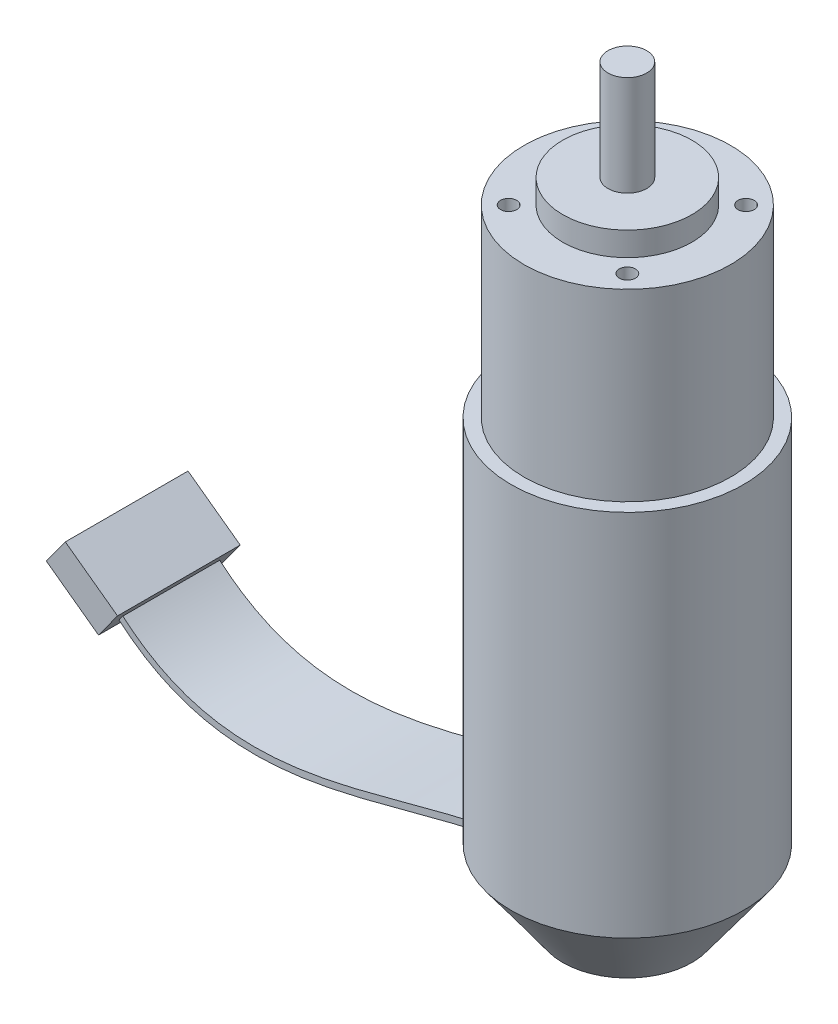
from build123d import *

# Parameters (mm, degrees)
SWEEP1_START              = -7.5
SWEEP1_DEPTH              = 15
SKETCH4_W                 = 19
SKETCH4_H                 = 5
BOSS_EXTRUDE1_DEPTH       = 10
M3X0_5_TAPPED_HOLE1_D     = 2.5
M3X0_5_TAPPED_HOLE1_DEPTH = 7.5
M3X0_5_TAPPED_HOLE1_TIP   = 0.751075774


with BuildPart() as part:
    # Sketch1 → Revolve1 (revolve)
    with BuildSketch(Plane.XY, mode=Mode.PRIVATE) as revolve1_sk:
        Polygon((0, 0), (-10, 0), (-18, 11), (-18, 68.1), (-16, 68.1), (-16, 96.6), (-10, 96.6), (-10, 100.3), (-3, 100.3), (-3, 115.8), (0, 115.8), align=None)
    revolve(revolve1_sk.sketch.rotate(Axis((0, 115.8, 0), (0, -1, 0)), 270), axis=Axis((0, 115.8, 0), (0, -1, 0)))

    # Sweep1: read off the stored shape, not the designer's step
    # Sweep1 outline → Sweep1 (add)
    with BuildSketch(Plane.XY.offset(SWEEP1_START)):
        with BuildLine():
            add(Edge.make_bspline(
                [(-15.28930073, 9.665917189), (-15.155241069, 9.50042506), (-15.020974619, 9.335100438), (-14.781588664, 9.041143621), (-14.67655559, 8.912441119), (-14.571379426, 8.783855646)],
                knots=[17.713260558, 17.713260558, 17.713260558, 17.713260558, 18.352193294, 18.352193294, 18.850555217, 18.850555217, 18.850555217, 18.850555217], degree=3))
            add(Edge.make_bspline(
                [(-15.28930073, 9.665917189), (-22.240343975, 8.202614741), (-29.318460029, 5.946043988), (-48.487680613, 1.623066579), (-60.300160331, 0.950060594), (-70.622683773, 9.904196742)],
                knots=[0.213963068, 0.213963068, 0.213963068, 0.213963068, 0.5, 0.5, 1, 1, 1, 1], degree=3))
            Line((-70.622683773, 9.904196742), (-71.211326259, 9.095803258))
            add(Edge.make_bspline(
                [(-14.571379426, 8.783855646), (-21.586501057, 7.343246642), (-28.814104178, 5.043485332), (-48.284336953, 0.638583113), (-60.500298128, -0.149792653), (-71.211326259, 9.095803258)],
                knots=[0.207983451, 0.207983451, 0.207983451, 0.207983451, 0.5, 0.5, 1, 1, 1, 1], degree=3))
        make_face()
    extrude(amount=SWEEP1_DEPTH)

    # Sketch4 → Boss-Extrude1 (add)
    with BuildSketch(Plane(origin=(-50.864884567, 37.037943446, 0), x_dir=(0, 0, 1), z_dir=(-0.8083934830959073, 0.5886424861391397, 0))):
        with Locations((0, -34.065024053)):
            Rectangle(SKETCH4_W, SKETCH4_H)
    extrude(amount=BOSS_EXTRUDE1_DEPTH)

    # M3x0.5 Tapped Hole1
    with Locations(Plane(origin=(0, 96.6, 0), x_dir=(1, 0, 0), z_dir=(0, 1, 0))):
        with Locations((9.192388155, 9.192388155), (9.192388155, -9.192388155), (-9.192388155, -9.192388155), (-9.192388155, 9.192388155)):
            Hole(M3X0_5_TAPPED_HOLE1_D / 2, depth=M3X0_5_TAPPED_HOLE1_DEPTH)
            with Locations((0, 0, -(M3X0_5_TAPPED_HOLE1_DEPTH + M3X0_5_TAPPED_HOLE1_TIP / 2))):  # 118° drill point
                Cone(0, M3X0_5_TAPPED_HOLE1_D / 2, M3X0_5_TAPPED_HOLE1_TIP, mode=Mode.SUBTRACT)


solid = part.part
